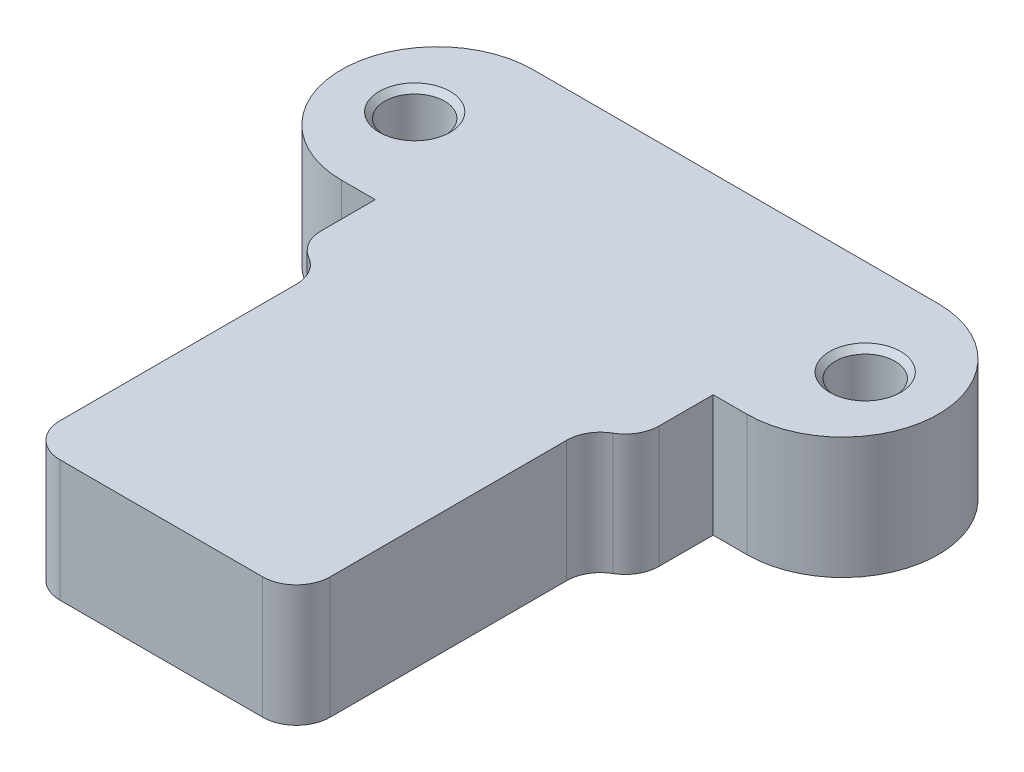
from build123d import *

# Parameters (mm, degrees)
SKETCH1_R           = 1.325
BOSS_EXTRUDE1_DEPTH = 5.4
CHAMFER2_SIZE       = 0.25
FILLET4_START       = -1
FILLET4_DEPTH       = 7
FILLET4_2_DEPTH     = 5.4
FILLET5_R           = 1.5


with BuildPart() as part:
    # Sketch1 → Boss-Extrude1 (new body)
    with BuildSketch(Plane(origin=(0, 0, 0), x_dir=(1, 0, 0), z_dir=(0, 1, 0))):
        with BuildLine():
            Line((-6, -7.75), (-6, -21.25))
            Line((-6, -21.25), (6, -21.25))
            Line((6, -21.25), (6, -7.75))
            Line((6, -7.75), (7.5, -7.75))
            Line((7.5, -7.75), (7.5, -4.25))
            Line((7.5, -4.25), (9, -4.25))
            ThreePointArc((9, -4.25), (13.25, 0), (9, 4.25))
            Line((9, 4.25), (-9, 4.25))
            ThreePointArc((-9, 4.25), (-13.25, 0), (-9, -4.25))
            Line((-9, -4.25), (-7.5, -4.25))
            Line((-7.5, -4.25), (-7.5, -7.75))
            Line((-7.5, -7.75), (-6, -7.75))
        make_face()
        with Locations(Location((-10, 0, 0), (0, 0, 90))):
            Circle(SKETCH1_R, mode=Mode.SUBTRACT)
        with Locations(Location((10, 0, 0), (0, 0, 90))):
            Circle(SKETCH1_R, mode=Mode.SUBTRACT)
    extrude(amount=BOSS_EXTRUDE1_DEPTH)

    # Chamfer2
    chamfer2_edges = [part.edges().sort_by_distance(p)[0] for p in [
        (-10, 0, 1.325),
        (-10, 5.4, 1.325),
        (10, 0, 1.325),
        (10, 5.4, 1.325),
    ]]
    chamfer(chamfer2_edges, length=CHAMFER2_SIZE)

    # Fillet4: read off the stored shape, not the designer's step
    # Fillet4 outline → Fillet4 (cut)
    with BuildSketch(Plane(origin=(0, 0, 0), x_dir=(1, 0, 0), z_dir=(0, 1, 0)).offset(FILLET4_START)):
        with BuildLine():
            ThreePointArc((6, -19.75), (5.560660172, -20.810660172), (4.5, -21.25))
            Line((4.5, -21.25), (6, -21.25))
            Line((6, -21.25), (6, -19.75))
        make_face()
        with BuildLine():
            ThreePointArc((-4.5, -21.25), (-5.560660172, -20.810660172), (-6, -19.75))
            Line((-6, -19.75), (-6, -21.25))
            Line((-6, -21.25), (-4.5, -21.25))
        make_face()
    extrude(amount=FILLET4_DEPTH, mode=Mode.SUBTRACT)

    # Fillet4 2 outline → Fillet4 2 (add)
    with BuildSketch(Plane(origin=(0, 0, 0), x_dir=(1, 0, 0), z_dir=(0, 1, 0))):
        with BuildLine():
            Line((6, -7.75), (6, -9.25))
            ThreePointArc((6, -9.25), (6.439339828, -8.189339828), (7.5, -7.75))
            Line((7.5, -7.75), (6, -7.75))
        make_face()
        with BuildLine():
            ThreePointArc((-7.5, -7.75), (-6.439339828, -8.189339828), (-6, -9.25))
            Line((-6, -9.25), (-6, -7.75))
            Line((-6, -7.75), (-7.5, -7.75))
        make_face()
    extrude(amount=FILLET4_2_DEPTH)

    # Fillet5
    fillet5_edges = [part.edges().sort_by_distance(p)[0] for p in [
        (7.5, 2.7, 7.75),
        (-7.5, 2.7, 7.75),
    ]]
    fillet(fillet5_edges, radius=FILLET5_R)


solid = part.part
